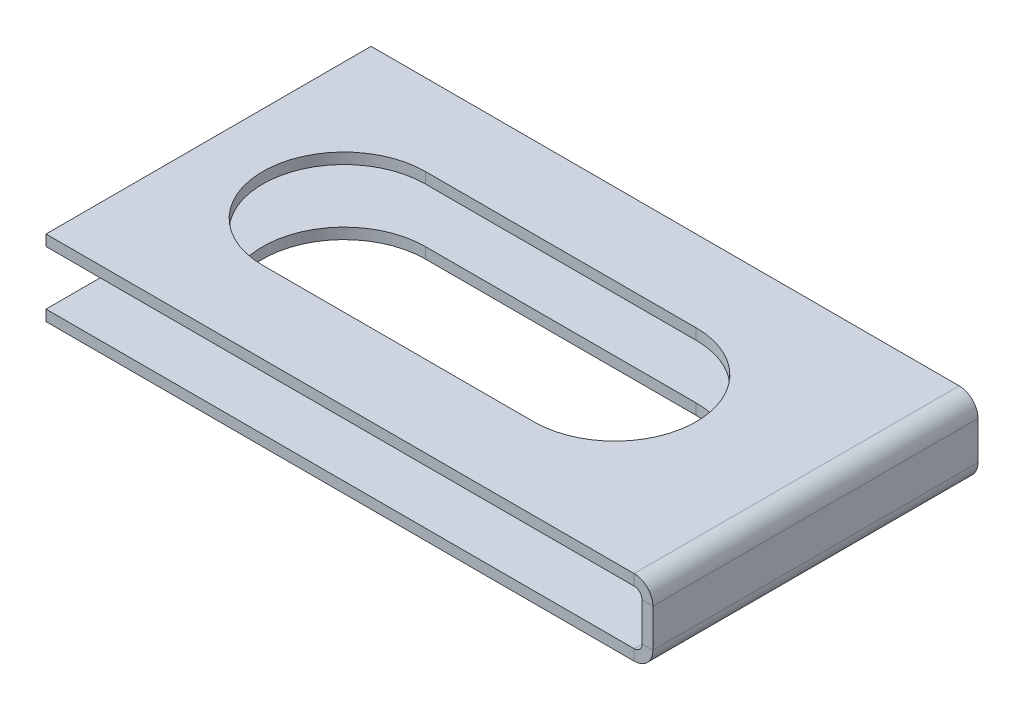
from build123d import *

# Parameters (mm, degrees)
ESQUISSE2_W                           = 55
ESQUISSE2_H                           = 30
T_LE_DE_BASE_PLI_E1_DEPTH             = 1
T_LE_PLI_E_SUR_AR_TE1_STRIP_W         = 5.4732
T_LE_PLI_E_SUR_AR_TE1_STRIP_H         = 1
T_LE_PLI_E_SUR_AR_TE1_STRIP_CUT_DEPTH = 30
T_LE_PLI_E_SUR_AR_TE1_DEPTH           = 30
T_LE_PLI_E_SUR_AR_TE2_STRIP_W         = 5.4732
T_LE_PLI_E_SUR_AR_TE2_STRIP_H         = 1
T_LE_PLI_E_SUR_AR_TE2_STRIP_CUT_DEPTH = 30
T_LE_PLI_E_SUR_AR_TE2_DEPTH           = 30
ENL_V_MAT_EXTRU_1_DEPTH               = 33.958306995
ESQUISSE29_R                          = 1.7
ENL_V_MAT_EXTRU_3_DEPTH               = 33.760494502


# Sheet-metal steps are written as plain solids
with BuildPart() as part:
    # Esquisse2 → Tôle de base pliée1 (new body)
    with BuildSketch(Plane(origin=(0, 0, 0), x_dir=(1, 0, 0), z_dir=(0, 1, 0))):
        Rectangle(ESQUISSE2_W, ESQUISSE2_H)
    extrude(amount=-T_LE_DE_BASE_PLI_E1_DEPTH)

    # Tôle pliée sur arête1 strip (across the edge) → Tôle pliée sur arête1 strip cut (cut)
    with BuildSketch(Plane(origin=(27.5, -1, -15), x_dir=(-1, 0, 0), z_dir=(0, 0, 1))):
        with Locations((-2, -0.5)):
            Rectangle(T_LE_PLI_E_SUR_AR_TE1_STRIP_W, T_LE_PLI_E_SUR_AR_TE1_STRIP_H)
    extrude(amount=T_LE_PLI_E_SUR_AR_TE1_STRIP_CUT_DEPTH, mode=Mode.SUBTRACT)

    # Tôle pliée sur arête1 section (across the edge) → Tôle pliée sur arête1 (add)
    with BuildSketch(Plane(origin=(27.5, -1, -15), x_dir=(-1, 0, 0), z_dir=(0, 0, 1))):
        with BuildLine():
            Line((-1, 0.7366), (-1, 5))
            Line((-1, 5), (0, 5))
            Line((0, 5), (0, 0.7366))
            ThreePointArc((0, 0.7366), (0.215745145, 0.215745145), (0.7366, 0))
            Line((0.7366, 0), (0.7366, -1))
            ThreePointArc((0.7366, -1), (-0.491361636, -0.491361636), (-1, 0.7366))
        make_face()
    extrude(amount=T_LE_PLI_E_SUR_AR_TE1_DEPTH)

    # Tôle pliée sur arête2 strip (across the edge) → Tôle pliée sur arête2 strip cut (cut)
    with BuildSketch(Plane(origin=(27.5, -6, -15), x_dir=(0, 1, 0), z_dir=(0, 0, 1))):
        with Locations((-2, -0.5)):
            Rectangle(T_LE_PLI_E_SUR_AR_TE2_STRIP_W, T_LE_PLI_E_SUR_AR_TE2_STRIP_H)
    extrude(amount=T_LE_PLI_E_SUR_AR_TE2_STRIP_CUT_DEPTH, mode=Mode.SUBTRACT)

    # Tôle pliée sur arête2 section (across the edge) → Tôle pliée sur arête2 (add)
    with BuildSketch(Plane(origin=(27.5, -6, -15), x_dir=(0, 1, 0), z_dir=(0, 0, 1))):
        with BuildLine():
            Line((-1, 0.7366), (-1, 55))
            Line((-1, 55), (0, 55))
            Line((0, 55), (0, 0.7366))
            ThreePointArc((0, 0.7366), (0.215745145, 0.215745145), (0.7366, 0))
            Line((0.7366, 0), (0.7366, -1))
            ThreePointArc((0.7366, -1), (-0.491361636, -0.491361636), (-1, 0.7366))
        make_face()
    extrude(amount=T_LE_PLI_E_SUR_AR_TE2_DEPTH)

    # Esquisse26 → Enlèv. mat.-Extru.1 (cut, through all)
    with BuildSketch(Plane(origin=(0, 0, 0), x_dir=(1, 0, 0), z_dir=(0, 1, 0))):
        with BuildLine():
            Line((-15, 7.5), (10, 7.5))
            ThreePointArc((10, 7.5), (17.5, 0), (10, -7.5))
            Line((10, -7.5), (-15, -7.5))
            ThreePointArc((-15, -7.5), (-22.5, 0), (-15, 7.5))
        make_face()
    extrude(amount=-ENL_V_MAT_EXTRU_1_DEPTH, mode=Mode.SUBTRACT)

    # Esquisse29 → Enlèv. mat.-Extru.3 (cut, through all)
    with BuildSketch(Plane(origin=(0, -6, 0), x_dir=(1, 0, 0), z_dir=(0, 1, 0))):
        with Locations(Location((24, 0, 0), (0, 0, 180))):
            Circle(ESQUISSE29_R)
    extrude(amount=-ENL_V_MAT_EXTRU_3_DEPTH, mode=Mode.SUBTRACT)


solid = part.part
